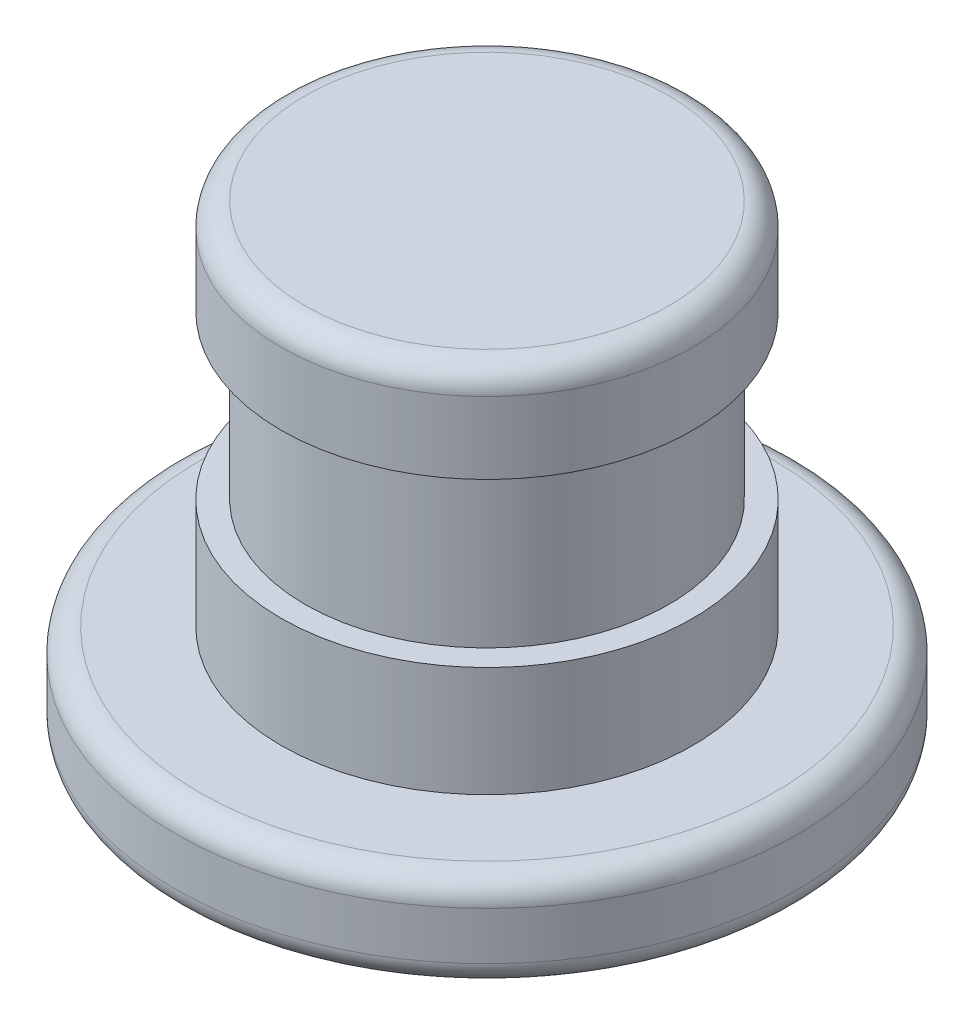
from build123d import *

# Parameters (mm, degrees)
ESBO_O1_R                = 6.5
RESSALTO_EXTRUS_O1_DEPTH = 2
ESBO_O2_R                = 4.3
RESSALTO_EXTRUS_O2_DEPTH = 2.3
ESBO_O3_R                = 3.8
RESSALTO_EXTRUS_O3_DEPTH = 3.4
ESBO_O4_R                = 4.3
RESSALTO_EXTRUS_O4_DEPTH = 2
FILETE1_R                = 0.5


with BuildPart() as part:
    # Esboço1 → Ressalto-extrusão1 (new body)
    with BuildSketch(Plane(origin=(0, 0, 0), x_dir=(1, 0, 0), z_dir=(0, 1, 0))):
        Circle(ESBO_O1_R)
    extrude(amount=-RESSALTO_EXTRUS_O1_DEPTH)

    # Esboço2 → Ressalto-extrusão2 (add)
    with BuildSketch(Plane(origin=(0, 0, 0), x_dir=(1, 0, 0), z_dir=(0, 1, 0))):
        Circle(ESBO_O2_R)
    extrude(amount=RESSALTO_EXTRUS_O2_DEPTH)

    # Esboço3 → Ressalto-extrusão3 (add)
    with BuildSketch(Plane(origin=(0, 2.3, 0), x_dir=(1, 0, 0), z_dir=(0, 1, 0))):
        Circle(ESBO_O3_R)
    extrude(amount=RESSALTO_EXTRUS_O3_DEPTH)

    # Esboço4 → Ressalto-extrusão4 (add)
    with BuildSketch(Plane(origin=(0, 5.7, 0), x_dir=(1, 0, 0), z_dir=(0, 1, 0))):
        Circle(ESBO_O4_R)
    extrude(amount=RESSALTO_EXTRUS_O4_DEPTH)

    # Filete1
    filete1_edges = [part.edges().sort_by_distance(p)[0] for p in [
        (-4.3, 7.7, 0),
        (-6.5, -2, 0),
        (-6.5, 0, 0),
    ]]
    fillet(filete1_edges, radius=FILETE1_R)


solid = part.part
